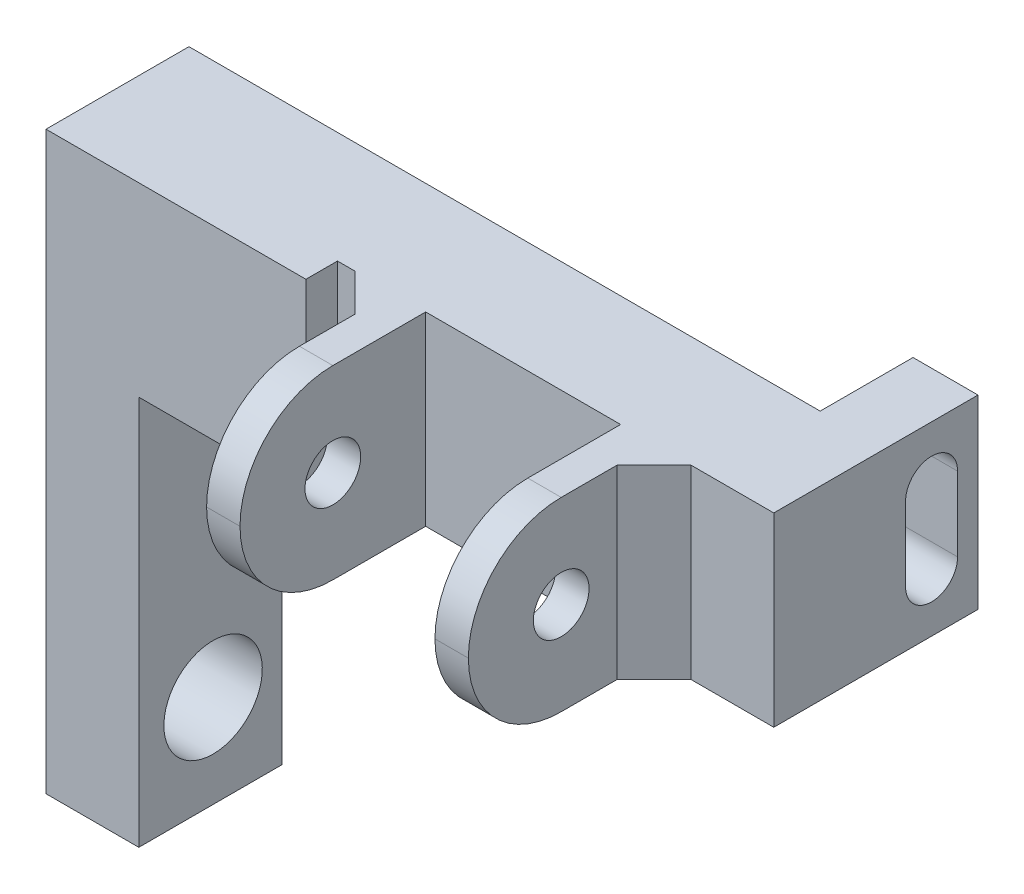
from build123d import *

# Parameters (mm, degrees)
SKETCH1_W           = 20
SKETCH1_H           = 30
SKETCH1_R           = 2.65
BOSS_EXTRUDE1_DEPTH = 3
SKETCH2_W           = 20
SKETCH2_H           = 10
BOSS_EXTRUDE2_DEPTH = 3
SKETCH3_W           = 1.8
SKETCH3_H           = 10
BOSS_EXTRUDE3_DEPTH = 10
FILLET1_R           = 5
CUT_EXTRUDE1_REACH  = 29.78
SKETCH4_R           = 1.5
CHAMFER1_SIZE       = 2
SKETCH5_W           = 20
SKETCH5_H           = 20
CUT_EXTRUDE2_DEPTH  = 10
SKETCH6_W           = 11
SKETCH6_H           = 10
BOSS_EXTRUDE4_DEPTH = 3.5
CUT_EXTRUDE3_DEPTH  = 3.5
SKETCH8_W           = 7.7
SKETCH8_H           = 31
SKETCH8_R           = 2.65
BOSS_EXTRUDE5_DEPTH = 14
SKETCH9_W           = 9
SKETCH9_H           = 21
CUT_EXTRUDE4_DEPTH  = 10


with BuildPart() as part:
    # Sketch1 → Boss-Extrude1 (new body)
    with BuildSketch(Plane.XY):
        Rectangle(SKETCH1_W, SKETCH1_H)
        with Locations((0, -10)):
            Circle(SKETCH1_R, mode=Mode.SUBTRACT)
        Circle(SKETCH1_R, mode=Mode.SUBTRACT)
    extrude(amount=BOSS_EXTRUDE1_DEPTH)

    # Sketch2 → Boss-Extrude2 (add)
    with BuildSketch(Plane.XY.offset(3)):
        with Locations((0, 10)):
            Rectangle(SKETCH2_W, SKETCH2_H)
    extrude(amount=BOSS_EXTRUDE2_DEPTH)

    # Sketch3 → Boss-Extrude3 (add)
    with BuildSketch(Plane.XY.offset(6)):
        with Locations((-6.15, 10)):
            Rectangle(SKETCH3_W, SKETCH3_H)
        with Locations((6.15, 10)):
            Rectangle(SKETCH3_W, SKETCH3_H)
    extrude(amount=BOSS_EXTRUDE3_DEPTH)

    # Fillet1
    fillet1_edges = [part.edges().sort_by_distance(p)[0] for p in [
        (6.15, 5, 16),
        (-6.15, 5, 16),
        (6.15, 15, 16),
        (-6.15, 15, 16),
    ]]
    fillet(fillet1_edges, radius=FILLET1_R - 0.0001)  # a hair under: the kernel refuses the full size

    # Cut-Extrude1: up to this face of the body (flat: up to its plane)
    cut_extrude1_end = Plane(part.part.faces().sort_by_distance((7.05, 10, 10.533268934))[0])
    # Sketch4 → Cut-Extrude1 (cut, up to the picked face)
    with BuildSketch(Plane.ZY.offset(7.05), mode=Mode.PRIVATE) as cut_extrude1_sk1:
        with Locations(Location((11, 10, 0), (0, 0, 270))):
            Circle(SKETCH4_R)
    cut_extrude1_tool1 = split(extrude(cut_extrude1_sk1.sketch, amount=-CUT_EXTRUDE1_REACH, mode=Mode.PRIVATE), bisect_by=cut_extrude1_end, keep=Keep.BOTH, mode=Mode.PRIVATE)
    add(cut_extrude1_tool1.solids().sort_by(Axis((-7.05, 10, 11), (1, 0, 0)))[0], mode=Mode.SUBTRACT)

    # Chamfer1
    chamfer1_edges = [part.edges().sort_by_distance(p)[0] for p in [
        (-7.05, 10, 6),
        (7.05, 10, 6),
    ]]
    chamfer(chamfer1_edges, length=CHAMFER1_SIZE)

    # Sketch5 → Cut-Extrude2 (cut)
    with BuildSketch(Plane.XY.offset(3)):
        with Locations((0, -5)):
            Rectangle(SKETCH5_W, SKETCH5_H)
    extrude(amount=-CUT_EXTRUDE2_DEPTH, mode=Mode.SUBTRACT)

    # Sketch6 → Boss-Extrude4 (add)
    with BuildSketch(Plane(origin=(10, 0, 0), x_dir=(0, 0, -1), z_dir=(1, 0, 0))):
        with Locations((-0.5, 10)):
            Rectangle(SKETCH6_W, SKETCH6_H)
    extrude(amount=BOSS_EXTRUDE4_DEPTH)

    # Sketch7 → Cut-Extrude3 (cut)
    with BuildSketch(Plane(origin=(13.5, 0, 0), x_dir=(0, 0, -1), z_dir=(1, 0, 0))):
        with BuildLine():
            Line((1.1, 8), (1.1, 12))
            ThreePointArc((1.1, 12), (2.5, 13.4), (3.9, 12))
            Line((3.9, 12), (3.9, 8))
            ThreePointArc((3.9, 8), (2.5, 6.6), (1.1, 8))
        make_face()
    extrude(amount=-CUT_EXTRUDE3_DEPTH, mode=Mode.SUBTRACT)

    # Sketch8 → Boss-Extrude5 (add)
    with BuildSketch(Plane.ZY.offset(10)):
        with Locations((3.85, -0.5)):
            Rectangle(SKETCH8_W, SKETCH8_H)
        with Locations((3.7, -11)):
            Circle(SKETCH8_R, mode=Mode.SUBTRACT)
    extrude(amount=BOSS_EXTRUDE5_DEPTH)

    # Sketch9 → Cut-Extrude4 (cut)
    with BuildSketch(Plane.XY.offset(7.7)):
        with Locations((-14.5, -5.5)):
            Rectangle(SKETCH9_W, SKETCH9_H)
    extrude(amount=-CUT_EXTRUDE4_DEPTH, mode=Mode.SUBTRACT)


solid = part.part
